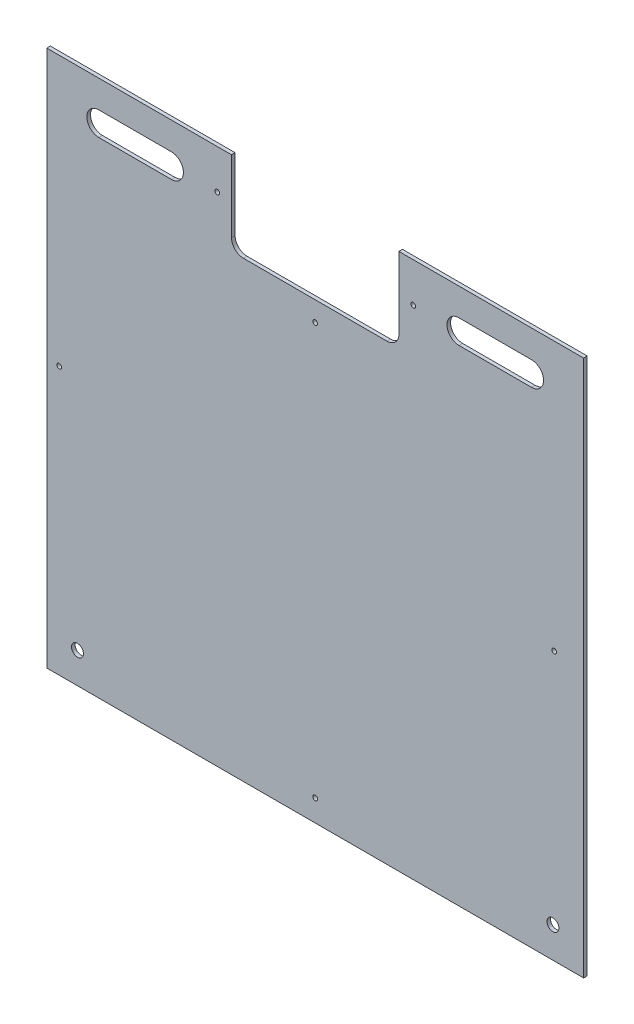
from build123d import *

# Parameters (mm, degrees)
SCHIZZO1_R                   = 2
SCHIZZO1_R_2                 = 5
ESTRUSIONE_ESTRUSIONE1_DEPTH = 3


with BuildPart() as part:
    # Schizzo1 → Estrusione-Estrusione1 (new body)
    with BuildSketch(Plane.XY):
        with BuildLine():
            Line((0, 0), (0, 449))
            Line((0, 449), (154.5, 449))
            Line((154.5, 449), (154.5, 389))
            ThreePointArc((154.5, 389), (157.428932188, 381.928932188), (164.5, 379))
            Line((164.5, 379), (284.5, 379))
            ThreePointArc((284.5, 379), (291.571067812, 381.928932188), (294.5, 389))
            Line((294.5, 389), (294.5, 449))
            Line((294.5, 449), (449, 449))
            Line((449, 449), (449, 0))
            Line((449, 0), (0, 0))
        make_face()
        with Locations((142.566643834, 415.9997554)):
            Circle(SCHIZZO1_R, mode=Mode.SUBTRACT)
        with Locations((224.5, 362.449018035)):
            Circle(SCHIZZO1_R, mode=Mode.SUBTRACT)
        with Locations((306.433356166, 415.9997554)):
            Circle(SCHIZZO1_R, mode=Mode.SUBTRACT)
        with Locations((10.404913938, 223.826386399)):
            Circle(SCHIZZO1_R, mode=Mode.SUBTRACT)
        with Locations((424.375938836, 224.5)):
            Circle(SCHIZZO1_R, mode=Mode.SUBTRACT)
        with Locations((224.5, 18.146776236)):
            Circle(SCHIZZO1_R, mode=Mode.SUBTRACT)
        with Locations((25.702490096, 25.702490096)):
            Circle(SCHIZZO1_R_2, mode=Mode.SUBTRACT)
        with Locations((423.297509904, 25.702490096)):
            Circle(SCHIZZO1_R_2, mode=Mode.SUBTRACT)
        with BuildLine():
            Line((344.715899345, 425.9997554), (405.440355678, 425.9997554))
            ThreePointArc((405.440355678, 425.9997554), (415.440355678, 415.9997554), (405.440355678, 405.9997554))
            Line((405.440355678, 405.9997554), (344.715899345, 405.9997554))
            ThreePointArc((344.715899345, 405.9997554), (334.715899345, 415.9997554), (344.715899345, 425.9997554))
        make_face(mode=Mode.SUBTRACT)
        with BuildLine():
            Line((104.284100655, 425.9997554), (43.559644322, 425.9997554))
            ThreePointArc((43.559644322, 425.9997554), (33.559644322, 415.9997554), (43.559644322, 405.9997554))
            Line((43.559644322, 405.9997554), (104.284100655, 405.9997554))
            ThreePointArc((104.284100655, 405.9997554), (114.284100655, 415.9997554), (104.284100655, 425.9997554))
        make_face(mode=Mode.SUBTRACT)
    extrude(amount=ESTRUSIONE_ESTRUSIONE1_DEPTH)


solid = part.part
